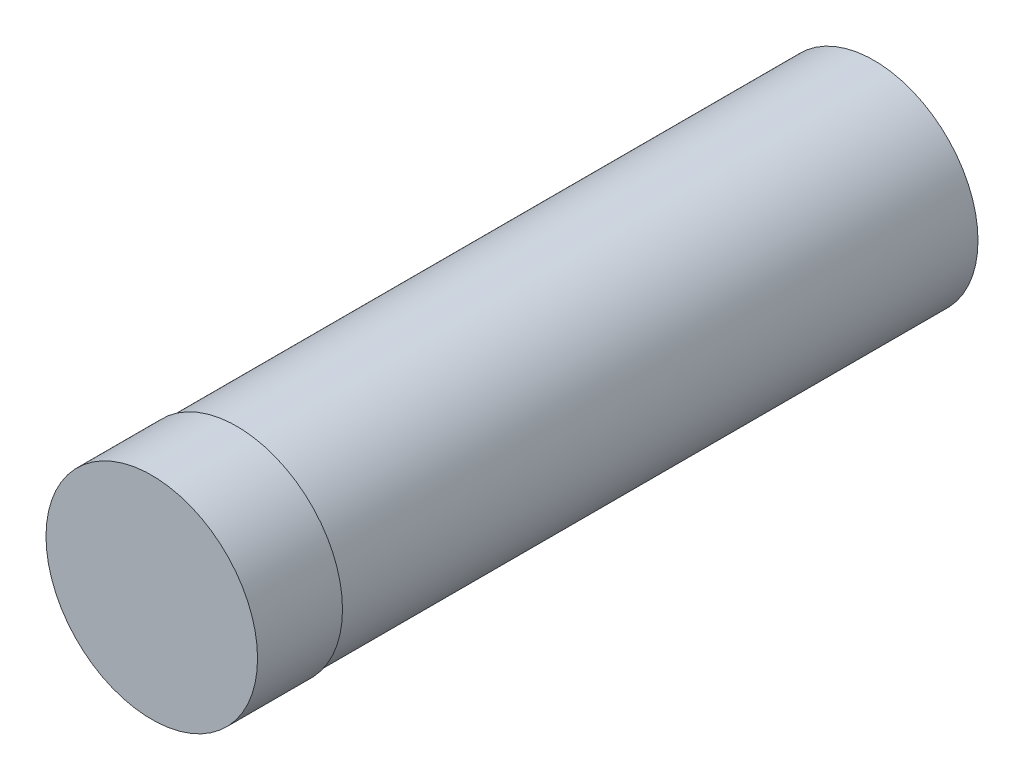
from build123d import *

# Parameters (mm, degrees)
SKETCH1_R           = 2.45
BOSS_EXTRUDE1_DEPTH = 8.5
SKETCH3_R           = 2.49
BOSS_EXTRUDE2_DEPTH = 2


with BuildPart() as part:
    # Sketch1 → Boss-Extrude1 (new, symmetric)
    with BuildSketch(Plane.XY):
        Circle(SKETCH1_R)
    extrude(amount=BOSS_EXTRUDE1_DEPTH, both=True)

    # Sketch3 → Boss-Extrude2 (add)
    with BuildSketch(Plane.XY.offset(8.5)):
        Circle(SKETCH3_R)
    extrude(amount=-BOSS_EXTRUDE2_DEPTH)


solid = part.part
